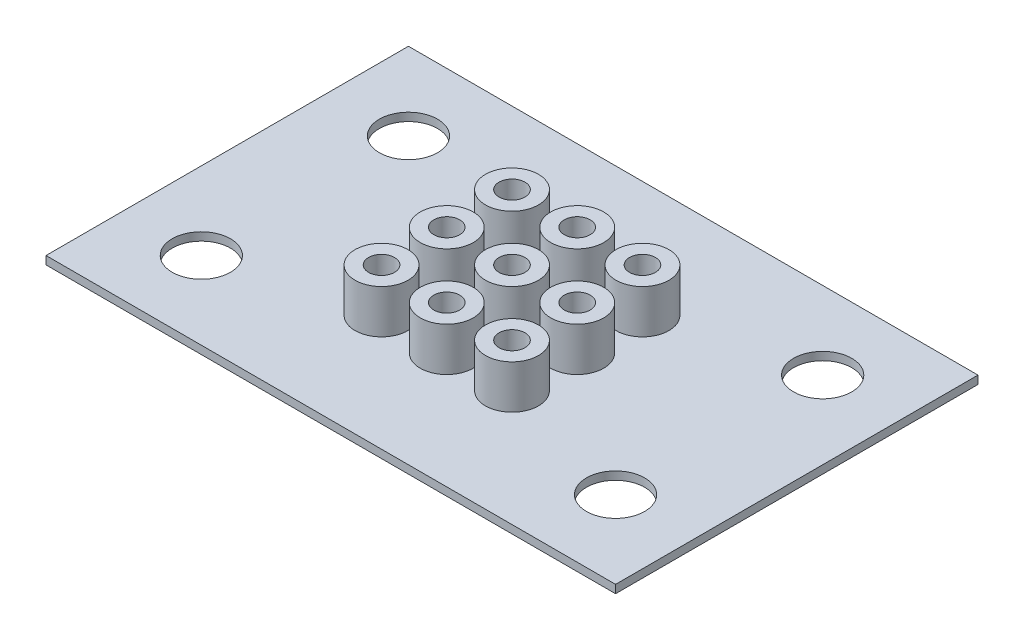
from build123d import *

# Parameters (mm, degrees)
SKETCH1_W           = 69.85
SKETCH1_H           = 44.45
SKETCH1_R           = 3.5687
SKETCH1_R_2         = 1.25
BOSS_EXTRUDE1_DEPTH = 1
SKETCH2_R           = 3.25
SKETCH2_R_2         = 1.59
BOSS_EXTRUDE2_DEPTH = 5.35


with BuildPart() as part:
    # Sketch1 → Boss-Extrude1 (new body)
    with BuildSketch(Plane(origin=(0, 0, 0), x_dir=(1, 0, 0), z_dir=(0, 1, 0))):
        with Locations((34.925, 22.225)):
            Rectangle(SKETCH1_W, SKETCH1_H)
        with Locations((9.525, 9.525)):
            Circle(SKETCH1_R, mode=Mode.SUBTRACT)
        with Locations((26.925, 14.225)):
            Circle(SKETCH1_R_2, mode=Mode.SUBTRACT)
        with Locations((26.925, 22.225)):
            Circle(SKETCH1_R_2, mode=Mode.SUBTRACT)
        with Locations((60.325, 9.525)):
            Circle(SKETCH1_R, mode=Mode.SUBTRACT)
        with Locations((34.925, 14.225)):
            Circle(SKETCH1_R_2, mode=Mode.SUBTRACT)
        with Locations((42.925, 14.225)):
            Circle(SKETCH1_R_2, mode=Mode.SUBTRACT)
        with Locations((26.925, 30.225)):
            Circle(SKETCH1_R_2, mode=Mode.SUBTRACT)
        with Locations((34.925, 30.225)):
            Circle(SKETCH1_R_2, mode=Mode.SUBTRACT)
        with Locations((9.525, 34.925)):
            Circle(SKETCH1_R, mode=Mode.SUBTRACT)
        with Locations((34.925, 22.225)):
            Circle(SKETCH1_R_2, mode=Mode.SUBTRACT)
        with Locations((42.925, 22.225)):
            Circle(SKETCH1_R_2, mode=Mode.SUBTRACT)
        with Locations((42.925, 30.225)):
            Circle(SKETCH1_R_2, mode=Mode.SUBTRACT)
        with Locations((60.325, 34.925)):
            Circle(SKETCH1_R, mode=Mode.SUBTRACT)
    extrude(amount=BOSS_EXTRUDE1_DEPTH)

    # Sketch2 → Boss-Extrude2 (add)
    # profile 1 of 9: a face of its own
    with BuildSketch(Plane(origin=(0, 1, 0), x_dir=(1, 0, 0), z_dir=(0, 1, 0))):
        with Locations((34.925, 22.225)):
            Circle(SKETCH2_R)
        with Locations((34.925, 22.225)):
            Circle(SKETCH2_R_2, mode=Mode.SUBTRACT)
    # profile 2 of 9: a face of its own
    with BuildSketch(Plane(origin=(0, 1, 0), x_dir=(1, 0, 0), z_dir=(0, 1, 0))):
        with Locations((42.925, 22.225)):
            Circle(SKETCH2_R)
        with Locations((42.925, 22.225)):
            Circle(SKETCH2_R_2, mode=Mode.SUBTRACT)
    # profile 3 of 9: a face of its own
    with BuildSketch(Plane(origin=(0, 1, 0), x_dir=(1, 0, 0), z_dir=(0, 1, 0))):
        with Locations((42.925, 30.225)):
            Circle(SKETCH2_R)
        with Locations((42.925, 30.225)):
            Circle(SKETCH2_R_2, mode=Mode.SUBTRACT)
    # profile 4 of 9: a face of its own
    with BuildSketch(Plane(origin=(0, 1, 0), x_dir=(1, 0, 0), z_dir=(0, 1, 0))):
        with Locations((34.925, 30.225)):
            Circle(SKETCH2_R)
        with Locations((34.925, 30.225)):
            Circle(SKETCH2_R_2, mode=Mode.SUBTRACT)
    # profile 5 of 9: a face of its own
    with BuildSketch(Plane(origin=(0, 1, 0), x_dir=(1, 0, 0), z_dir=(0, 1, 0))):
        with Locations((42.925, 14.225)):
            Circle(SKETCH2_R)
        with Locations((42.925, 14.225)):
            Circle(SKETCH2_R_2, mode=Mode.SUBTRACT)
    # profile 6 of 9: a face of its own
    with BuildSketch(Plane(origin=(0, 1, 0), x_dir=(1, 0, 0), z_dir=(0, 1, 0))):
        with Locations((34.925, 14.225)):
            Circle(SKETCH2_R)
        with Locations((34.925, 14.225)):
            Circle(SKETCH2_R_2, mode=Mode.SUBTRACT)
    # profile 7 of 9: a face of its own
    with BuildSketch(Plane(origin=(0, 1, 0), x_dir=(1, 0, 0), z_dir=(0, 1, 0))):
        with Locations((26.925, 22.225)):
            Circle(SKETCH2_R)
        with Locations((26.925, 22.225)):
            Circle(SKETCH2_R_2, mode=Mode.SUBTRACT)
    # profile 8 of 9: a face of its own
    with BuildSketch(Plane(origin=(0, 1, 0), x_dir=(1, 0, 0), z_dir=(0, 1, 0))):
        with Locations((26.925, 30.225)):
            Circle(SKETCH2_R)
        with Locations((26.925, 30.225)):
            Circle(SKETCH2_R_2, mode=Mode.SUBTRACT)
    # profile 9 of 9: a face of its own
    with BuildSketch(Plane(origin=(0, 1, 0), x_dir=(1, 0, 0), z_dir=(0, 1, 0))):
        with Locations((26.925, 14.225)):
            Circle(SKETCH2_R)
        with Locations((26.925, 14.225)):
            Circle(SKETCH2_R_2, mode=Mode.SUBTRACT)
    extrude(amount=BOSS_EXTRUDE2_DEPTH)


solid = part.part
